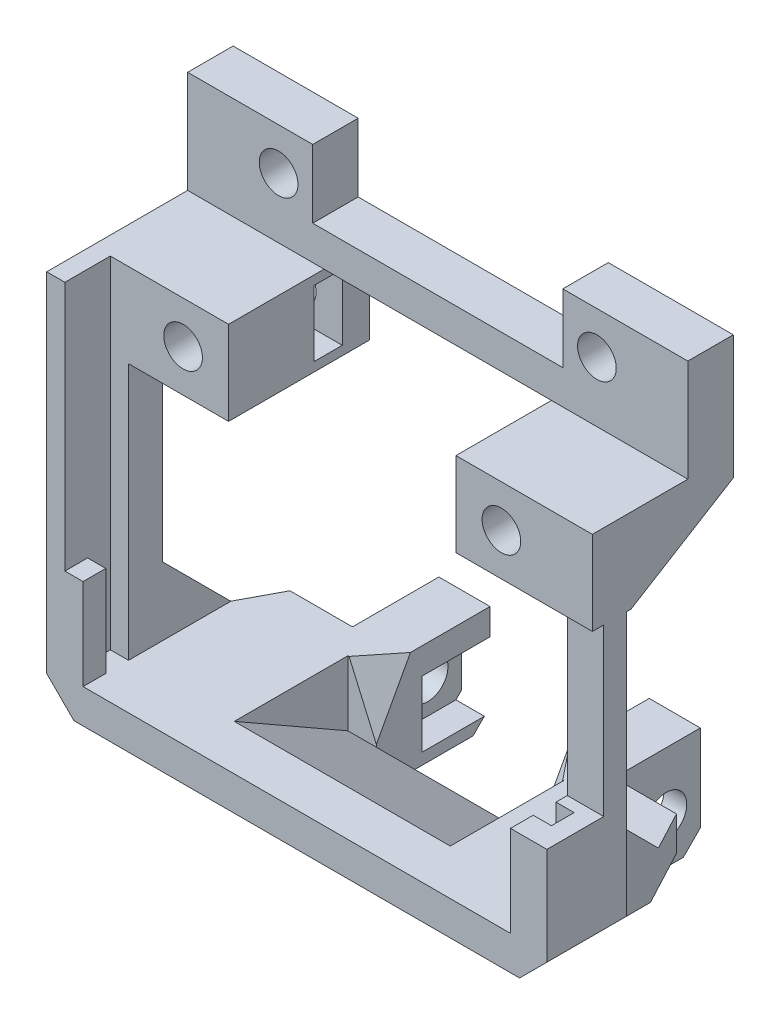
from build123d import *

# Parameters (mm, degrees)
SKETCH_1_W                = 44
SKETCH_1_H                = 34
EXTRUDE_1_DEPTH           = 24
CUT_EXTRUDE_1_DEPTH       = 31
SKETCH_5_W                = 23
SKETCH_5_H                = 6.11
EXTRUDE_4_DEPTH           = 1
EXTRUDE_5_DEPTH           = 23
SKETCH_7_R                = 1.8
CUT_EXTRUDE_2_DEPTH       = 23
CUT_EXTRUDE_4_DEPTH       = 14
SKETCH_11_R               = 1.7
EXTRUDE_6_DEPTH           = 20
CUT_EXTRUDE_7_DEPTH       = 4
CHAMFER_3_SIZE            = 2.4
SKETCH_14_W               = 40.8
SKETCH_14_H               = 4
CUT_EXTRUDE_8_DEPTH       = 23
SKETCH_15_W               = 44
SKETCH_15_H               = 1
CUT_EXTRUDE_9_DEPTH       = 24
SKETCH_16_W               = 3.2
SKETCH_16_H               = 14.6
CUT_EXTRUDE_10_DEPTH      = 5
CUT_EXTRUDE_12_DEPTH      = 10
CUT_EXTRUDE_12_DEPTH_BACK = 17
SKETCH_19_W               = 1
SKETCH_19_H               = 6.11
CUT_EXTRUDE_13_DEPTH      = 23
CHAMFER_4_SIZE            = 1.5
SKETCH_22_W               = 34
SKETCH_22_H               = 7.4
SKETCH_22_W_2             = 5.5
SKETCH_22_H_2             = 3
CUT_EXTRUDE_14_DEPTH      = 7.6
SKETCH_23_W               = 6
SKETCH_23_H               = 5.8
CUT_EXTRUDE_15_DEPTH      = 2.5
SKETCH_25_W               = 2.5
SKETCH_25_H               = 5.8
CUT_EXTRUDE_17_DEPTH      = 7
SKETCH_26_W               = 34
SKETCH_26_H               = 4
EXTRUDE_7_DEPTH           = 9
SKETCH_27_W               = 22
SKETCH_27_H               = 4.9
CUT_EXTRUDE_18_DEPTH      = 6
SKETCH_28_R               = 1.7
CUT_EXTRUDE_19_DEPTH      = 4
CHAMFER_5_SIZE            = 5
CHAMFER_5_SIZE_2          = 9.4
CHAMFER_6_SIZE            = 5
CHAMFER_6_SIZE_2          = 9.4
SKETCH_30_W               = 5
SKETCH_30_H               = 7.4
EXTRUDE_8_DEPTH           = 9.4
SKETCH_32_W               = 5
SKETCH_32_H               = 4
EXTRUDE_9_DEPTH           = 9
SKETCH_33_W               = 1.6
SKETCH_33_H               = 4
CUT_EXTRUDE_20_DEPTH      = 7.4
CHAMFER_START             = 3.158134344
CHAMFER_7_DEPTH           = 2.841865656
CHAMFER_START_2           = -6
CHAMFER_8_DEPTH           = 2.841865656
CHAMFER_START_3           = 9
CHAMFER_9_DEPTH           = 4.404008624
CHAMFER_START_4           = -13.404008624
CHAMFER_10_DEPTH          = 14.281940081
CHAMFER_11_SIZE           = 6
CHAMFER_12_SIZE           = 6


with BuildPart() as part:
    # Эскиз1 → Бобышка-Вытянуть1 (new body)
    with BuildSketch(Plane.XY):
        with Locations((0, 27)):
            Rectangle(SKETCH_1_W, SKETCH_1_H)
    extrude(amount=EXTRUDE_1_DEPTH)

    # Эскиз2 → Вырез-Вытянуть1 (cut)
    with BuildSketch(Plane(origin=(0, 44, 0), x_dir=(1, 0, 0), z_dir=(0, 1, 0))):
        Polygon((-18.8, 0), (18.8, 0), (18.8, -20), (20.4, -20), (20.4, -22), (18.8, -22), (18.8, -24), (-18.8, -24), (-18.8, -22), (-20.4, -22), (-20.4, -20), (-18.8, -20), align=None)
    extrude(amount=-CUT_EXTRUDE_1_DEPTH, mode=Mode.SUBTRACT)



with BuildPart() as body_2:
    # Эскиз5 → Бобышка-Вытянуть4 (new body)
    with BuildSketch(Plane(origin=(0, 0, 0), x_dir=(-1, 0, 0), z_dir=(0, 0, -1))):
        with Locations((0, 6.945)):
            Rectangle(SKETCH_5_W, SKETCH_5_H)
    extrude(amount=EXTRUDE_4_DEPTH)


with BuildPart() as part_1:
    add(part.part)

    add(body_2.part)  # Бобышка-Вытянуть5 merges body 2
    # Эскиз6 → Бобышка-Вытянуть5 (add)
    with BuildSketch(Plane(origin=(11.5, 0, 0), x_dir=(0, 0, -1), z_dir=(1, 0, 0))):
        Polygon((0, 3.89), (-7, 3.89), (-24, 10), (0, 10), align=None)
    extrude(amount=-EXTRUDE_5_DEPTH)

    # Эскиз7 → Вырез-Вытянуть2 (cut)
    with BuildSketch(Plane.ZY.offset(11.5)):
        with Locations(Location((3, 7.79, 0), (0, 0, 270))):
            Circle(SKETCH_7_R)
    extrude(amount=-CUT_EXTRUDE_2_DEPTH, mode=Mode.SUBTRACT)

    # Эскиз8 → Вырез-Вытянуть4 (cut)
    with BuildSketch(Plane.ZY.offset(7)):
        Polygon((20, 13), (-1, 13), (-1, 3.89), (10, 3.89), (10, 7.278569391), align=None)
    extrude(amount=-CUT_EXTRUDE_4_DEPTH, mode=Mode.SUBTRACT)

    # Эскиз11 → Бобышка-Вытянуть6 (add)
    # profile 1 of 2: a face of its own
    with BuildSketch(Plane(origin=(0, 0, 0), x_dir=(-1, 0, 0), z_dir=(0, 0, -1))):
        Polygon((-14, 43), (-18.8, 43), (-18.8, 35.6), (-14, 35.6), (-10, 35.6), (-10, 43), align=None)
        with Locations((-14, 39.3)):
            Circle(SKETCH_11_R, mode=Mode.SUBTRACT)
    # profile 2 of 2: a face of its own
    with BuildSketch(Plane(origin=(0, 0, 0), x_dir=(-1, 0, 0), z_dir=(0, 0, -1))):
        Polygon((18.8, 35.6), (14, 35.6), (10, 35.6), (10, 43), (14, 43), (18.8, 43), align=None)
        with Locations((14, 39.3)):
            Circle(SKETCH_11_R, mode=Mode.SUBTRACT)
    extrude(amount=-EXTRUDE_6_DEPTH)

    # Эскиз13 → Вырез-Вытянуть7 (cut)
    with BuildSketch(Plane.ZY.offset(22)):
        Polygon((9, 34), (17, 36), (17, 33.5), (9, 31.5), align=None)
        Polygon((9, 30.5), (17, 32.5), (17, 30), (9, 28), align=None)
        Polygon((9, 27), (17, 29), (17, 26.5), (9, 24.5), align=None)
        Polygon((9, 23.5), (17, 25.5), (17, 23), (9, 21), align=None)
        Polygon((9, 20), (17, 22), (17, 19.5), (9, 17.5), align=None)
    cut_extrude_7 = extrude(amount=-CUT_EXTRUDE_7_DEPTH, mode=Mode.SUBTRACT)

    # Зеркальное отражение1: Вырез-Вытянуть7 across plane
    add(cut_extrude_7.mirror(Plane(origin=(0, 0, 0), x_dir=(0, 0, 1), z_dir=(1, 0, 0))), mode=Mode.SUBTRACT)

    # Фаска3
    chamfer_3_edges = [part_1.edges().sort_by_distance(p)[0] for p in [
        (22, 10, 12),
        (-22, 10, 12),
    ]]
    chamfer(chamfer_3_edges, length=CHAMFER_3_SIZE)

    # Эскиз14 → Вырез-Вытянуть8 (cut)
    with BuildSketch(Plane(origin=(0, 44, 0), x_dir=(1, 0, 0), z_dir=(0, 1, 0))):
        with Locations((0, -22)):
            Rectangle(SKETCH_14_W, SKETCH_14_H)
    extrude(amount=-CUT_EXTRUDE_8_DEPTH, mode=Mode.SUBTRACT)

    # Эскиз15 → Вырез-Вытянуть9 (cut)
    with BuildSketch(Plane(origin=(0, 0, 0), x_dir=(-1, 0, 0), z_dir=(0, 0, -1))):
        with Locations((0, 43.5)):
            Rectangle(SKETCH_15_W, SKETCH_15_H)
    extrude(amount=-CUT_EXTRUDE_9_DEPTH, mode=Mode.SUBTRACT)

    # Эскиз16 → Вырез-Вытянуть10 (cut)
    with BuildSketch(Plane.XY.offset(24)):
        with Locations((20.4, 28.3)):
            Rectangle(SKETCH_16_W, SKETCH_16_H)
    extrude(amount=-CUT_EXTRUDE_10_DEPTH, mode=Mode.SUBTRACT)

    # Эскиз18 → Вырез-Вытянуть12 (cut, two sides: drawn at the far end of the back side and taken through both)
    with BuildSketch(Plane(origin=(0, 0, 0), x_dir=(-1, 0, 0), z_dir=(0, 0, -1)).offset(-CUT_EXTRUDE_12_DEPTH_BACK)):
        Polygon((-22, 43), (-17, 43), (-17, 10), (-19.6, 10), (-22, 12.4), align=None)
        Polygon((22, 12.4), (19.6, 10), (17, 10), (17, 43), (22, 43), align=None)
    extrude(amount=CUT_EXTRUDE_12_DEPTH + CUT_EXTRUDE_12_DEPTH_BACK, mode=Mode.SUBTRACT)

    # Эскиз19 → Вырез-Вытянуть13 (cut)
    with BuildSketch(Plane.ZY.offset(11.5)):
        with Locations((-0.5, 6.945)):
            Rectangle(SKETCH_19_W, SKETCH_19_H)
    extrude(amount=-CUT_EXTRUDE_13_DEPTH, mode=Mode.SUBTRACT)

    # Фаска4
    chamfer_4_edges = [part_1.edges().sort_by_distance(p)[0] for p in [
        (-9.25, 3.89, 0),
        (9.25, 3.89, 0),
    ]]
    chamfer(chamfer_4_edges, length=CHAMFER_4_SIZE)

    # Эскиз22 → Вырез-Вытянуть14 (cut)
    with BuildSketch(Plane(origin=(0, 0, 0), x_dir=(-1, 0, 0), z_dir=(0, 0, -1))):
        with Locations((0, 39.3)):
            Rectangle(SKETCH_22_W, SKETCH_22_H)
        with Locations((-14.25, 11.5)):
            Rectangle(SKETCH_22_W_2, SKETCH_22_H_2)
        with Locations((14.25, 11.5)):
            Rectangle(SKETCH_22_W_2, SKETCH_22_H_2)
    extrude(amount=-CUT_EXTRUDE_14_DEPTH, mode=Mode.SUBTRACT)

    # Эскиз23 → Вырез-Вытянуть15 (cut)
    with BuildSketch(Plane(origin=(-7, 0, 0), x_dir=(0, 0, -1), z_dir=(1, 0, 0))):
        with Locations((-3, 7.79)):
            Rectangle(SKETCH_23_W, SKETCH_23_H)
        Polygon((-20, 13), (-10, 7.278569391), (-10, 13), align=None)
    cut_extrude_15 = extrude(amount=-CUT_EXTRUDE_15_DEPTH, mode=Mode.SUBTRACT)

    # Зеркальное отражение2: Вырез-Вытянуть15 across plane
    add(cut_extrude_15.mirror(Plane(origin=(0, 0, 0), x_dir=(0, 0, 1), z_dir=(1, 0, 0))), mode=Mode.SUBTRACT)

    # Эскиз25 → Вырез-Вытянуть17 (cut)
    with BuildSketch(Plane(origin=(17, 0, 0), x_dir=(0, 0, -1), z_dir=(1, 0, 0))):
        with Locations((-11.25, 39.3)):
            Rectangle(SKETCH_25_W, SKETCH_25_H)
    cut_extrude_17 = extrude(amount=-CUT_EXTRUDE_17_DEPTH, mode=Mode.SUBTRACT)

    # Зеркальное отражение3: Вырез-Вытянуть17 across plane
    add(cut_extrude_17.mirror(Plane(origin=(0, 0, 0), x_dir=(0, 0, 1), z_dir=(1, 0, 0))), mode=Mode.SUBTRACT)

    # Эскиз26 → Бобышка-Вытянуть7 (add)
    with BuildSketch(Plane(origin=(0, 43, 0), x_dir=(1, 0, 0), z_dir=(0, 1, 0))):
        with Locations((0, -9.6)):
            Rectangle(SKETCH_26_W, SKETCH_26_H)
    extrude(amount=EXTRUDE_7_DEPTH)

    # Эскиз27 → Вырез-Вытянуть18 (cut)
    with BuildSketch(Plane(origin=(0, 52, 0), x_dir=(1, 0, 0), z_dir=(0, 1, 0))):
        with Locations((0, -10.05)):
            Rectangle(SKETCH_27_W, SKETCH_27_H)
    extrude(amount=-CUT_EXTRUDE_18_DEPTH, mode=Mode.SUBTRACT)

    # Эскиз28 → Вырез-Вытянуть19 (cut)
    with BuildSketch(Plane.XY.offset(11.6)):
        with Locations((-14, 48.3)):
            Circle(SKETCH_28_R)
        with Locations(Location((14, 48.3, 0), (0, 0, 180))):
            Circle(SKETCH_28_R)
    extrude(amount=-CUT_EXTRUDE_19_DEPTH, mode=Mode.SUBTRACT)

    # Фаска5
    # the kernel refuses this chamfer: 9.4, 5 mm, written as the material it adds along each edge
    with BuildSketch(Plane(origin=(-17, 10, 17), x_dir=(-1, 0, 0), z_dir=(0, 1, 0))) as chamfer_5_piece_1_section:
        Polygon((CHAMFER_5_SIZE, 0), (0, -CHAMFER_5_SIZE_2), (0, 0), align=None)
    chamfer_5_piece_1 = extrude(amount=3, mode=Mode.PRIVATE)
    chamfer_5_piece_1 = split(chamfer_5_piece_1, bisect_by=Plane(origin=(-18.3, 8.7, 17), z_dir=(0.7071067811865478, 0.7071067811865474, 0)), keep=Keep.TOP, mode=Mode.PRIVATE)
    add(chamfer_5_piece_1)

    # Фаска6
    # the kernel refuses this chamfer: 9.4, 5 mm, written as the material it adds along each edge
    with BuildSketch(Plane(origin=(17, 13, 17), x_dir=(1, 0, 0), z_dir=(0, -1, 0))) as chamfer_6_piece_1_section:
        Polygon((CHAMFER_6_SIZE, 0), (0, -CHAMFER_6_SIZE_2), (0, 0), align=None)
    chamfer_6_piece_1 = extrude(amount=3, mode=Mode.PRIVATE)
    chamfer_6_piece_1 = split(chamfer_6_piece_1, bisect_by=Plane(origin=(19.8, 10.2, 17), z_dir=(-0.7071067811865478, 0.7071067811865474, 0)), keep=Keep.TOP, mode=Mode.PRIVATE)
    add(chamfer_6_piece_1)

    # Эскиз30 → Бобышка-Вытянуть8 (add)
    with BuildSketch(Plane(origin=(0, 0, 7.6), x_dir=(-1, 0, 0), z_dir=(0, 0, -1))):
        with Locations((-19.5, 39.3)):
            Rectangle(SKETCH_30_W, SKETCH_30_H)
        with Locations((19.5, 39.3)):
            Rectangle(SKETCH_30_W, SKETCH_30_H)
    extrude(amount=-EXTRUDE_8_DEPTH)

    # Эскиз32 → Бобышка-Вытянуть9 (add)
    with BuildSketch(Plane(origin=(0, 52, 0), x_dir=(1, 0, 0), z_dir=(0, 1, 0))):
        with Locations((-19.5, -9.6)):
            Rectangle(SKETCH_32_W, SKETCH_32_H)
        with Locations((19.5, -9.6)):
            Rectangle(SKETCH_32_W, SKETCH_32_H)
    extrude(amount=-EXTRUDE_9_DEPTH)

    # Эскиз33 → Вырез-Вытянуть20 (cut)
    with BuildSketch(Plane(origin=(0, 43, 0), x_dir=(1, 0, 0), z_dir=(0, 1, 0))):
        with Locations((21.2, -22)):
            Rectangle(SKETCH_33_W, SKETCH_33_H)
    extrude(amount=-CUT_EXTRUDE_20_DEPTH, mode=Mode.SUBTRACT)

    # Фаска7: read off the stored shape, not the designer's step
    # Фаска7 outline → Фаска7 (cut)
    with BuildSketch(Plane(origin=(0, 0, 0), x_dir=(0.6735542111960274, -0.35393772244377236, -0.648885824480249), z_dir=(0.7391378251585405, 0.3225328691600908, 0.5913102601268327)).offset(CHAMFER_START)):
        Polygon((-13.858270642, 1.79569549), (-13.858270642, 8.060677533), (-17.421458222, 6.624121141), align=None)
    extrude(amount=CHAMFER_7_DEPTH, mode=Mode.SUBTRACT)

    # Фаска8: read off the stored shape, not the designer's step
    # Фаска8 outline → Фаска8 (cut)
    with BuildSketch(Plane(origin=(0, 0, 0), x_dir=(0.6735542111960274, 0.35393772244377236, 0.648885824480249), z_dir=(0.7391378251585405, -0.3225328691600908, -0.5913102601268327)).offset(CHAMFER_START_2)):
        Polygon((17.421458222, -6.624121141), (13.858270642, -1.79569549), (13.858270642, -8.060677533), align=None)
    extrude(amount=CHAMFER_8_DEPTH, mode=Mode.SUBTRACT)

    # Фаска9: read off the stored shape, not the designer's step
    # Фаска9 outline → Фаска9 (cut)
    with BuildSketch(Plane(origin=(0, 0, 0), x_dir=(0.7291332431365165, -0.583961995177201, -0.35686566371940037), z_dir=(0.6843717657481387, 0.6221561506801269, 0.3802065365267439)).offset(CHAMFER_START_3)):
        Polygon((-42.753948395, 4.399141898), (-35.896491206, 12.078678401), (-42.753948395, 14.946653453), align=None)
    extrude(amount=CHAMFER_9_DEPTH, mode=Mode.SUBTRACT)

    # Фаска10: read off the stored shape, not the designer's step
    # Фаска10 outline → Фаска10 (cut)
    with BuildSketch(Plane(origin=(0, 0, 0), x_dir=(0.7291332431365165, 0.583961995177201, 0.35686566371940037), z_dir=(0.6843717657481387, -0.6221561506801269, -0.3802065365267439)).offset(CHAMFER_START_4)):
        Polygon((42.753948395, -4.399141898), (35.896491206, -12.078678401), (42.753948395, -14.946653453), align=None)
    extrude(amount=CHAMFER_10_DEPTH, mode=Mode.SUBTRACT)

    # Фаска11
    chamfer_11_edges = [part_1.edges().sort_by_distance(p)[0] for p in [
        (-20.4, 13, 17),
    ]]
    chamfer(chamfer_11_edges, length=CHAMFER_11_SIZE)

    # Фаска12
    chamfer_12_edges = [part_1.edges().sort_by_distance(p)[0] for p in [
        (20.4, 13, 17),
    ]]
    chamfer(chamfer_12_edges, length=CHAMFER_12_SIZE)


solid = part_1.part
